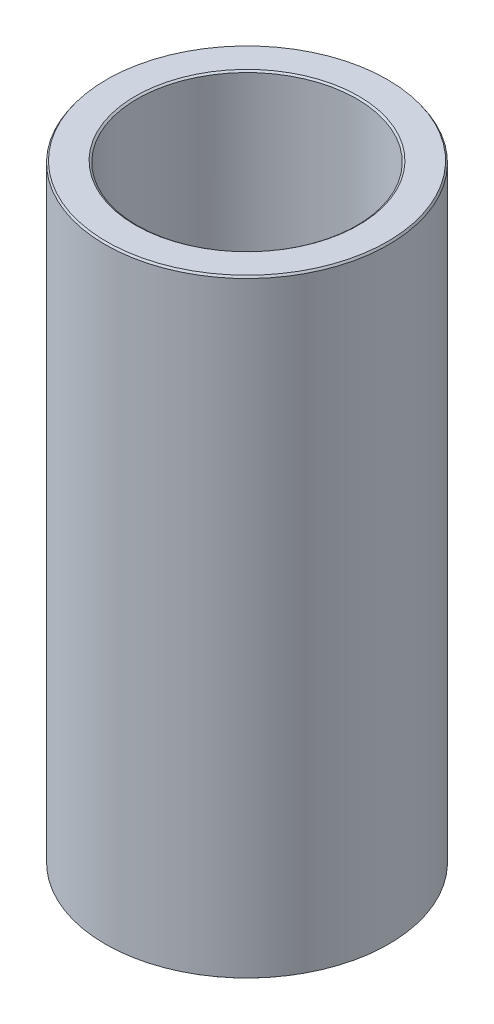
from build123d import *
from OCP.BRepFilletAPI import BRepFilletAPI_MakeChamfer

# Parameters (mm, degrees)
SKETCH1_R           = 35
BOSS_EXTRUDE1_DEPTH = 150.343041636
SKETCH2_R           = 27.102087531
CUT_EXTRUDE1_DEPTH  = 159.28149029
CHAMFER1_SIZE       = 0.471211475
CHAMFER1_SIZE2      = 0.338114798


with BuildPart() as part:
    # Sketch1 → Boss-Extrude1 (new body)
    with BuildSketch(Plane(origin=(0, 0, 0), x_dir=(1, 0, 0), z_dir=(0, 1, 0))):
        Circle(SKETCH1_R)
    extrude(amount=BOSS_EXTRUDE1_DEPTH)

    # Sketch2 → Cut-Extrude1 (cut, through all)
    with BuildSketch(Plane(origin=(0, 0, 0), x_dir=(1, 0, 0), z_dir=(0, 1, 0))):
        Circle(SKETCH2_R)
    extrude(amount=CUT_EXTRUDE1_DEPTH, mode=Mode.SUBTRACT)

    # Chamfer1: one chamfer whose edges measure the first distance from different faces: ONE call of the kernel's chamfer builder (chamfer() names one face for all edges)
    chamfer1_edges_1 = [part.edges().sort_by_distance(p)[0] for p in [
        (-27.102087531, 150.343041636, 0),
    ]]
    chamfer1_side_1 = [part.faces().sort_by_distance(p)[0] for p in [
        (-34.010050506, 150.343041636, 0),
    ]]
    chamfer1_edges_2 = [part.edges().sort_by_distance(p)[0] for p in [
        (-27.102087531, 0, 0),
    ]]
    chamfer1_side_2 = [part.faces().sort_by_distance(p)[0] for p in [
        (-27.102087531, 75.171520818, 0),
    ]]
    chamfer1_edges_3 = [part.edges().sort_by_distance(p)[0] for p in [
        (-35, 0, 0),
    ]]
    chamfer1_side_3 = [part.faces().sort_by_distance(p)[0] for p in [
        (-34.010050506, 0, 0),
    ]]
    chamfer1_edges_4 = [part.edges().sort_by_distance(p)[0] for p in [
        (-35, 150.343041636, 0),
    ]]
    chamfer1_side_4 = [part.faces().sort_by_distance(p)[0] for p in [
        (-35, 75.171520818, 0),
    ]]
    chamfer1 = BRepFilletAPI_MakeChamfer(part.part.solid().wrapped)
    for e in chamfer1_edges_1:
        chamfer1.Add(CHAMFER1_SIZE, CHAMFER1_SIZE2, e.wrapped, chamfer1_side_1[0].wrapped)  # the first distance lies on this face
    for e in chamfer1_edges_2:
        chamfer1.Add(CHAMFER1_SIZE, CHAMFER1_SIZE2, e.wrapped, chamfer1_side_2[0].wrapped)  # the first distance lies on this face
    for e in chamfer1_edges_3:
        chamfer1.Add(CHAMFER1_SIZE, CHAMFER1_SIZE2, e.wrapped, chamfer1_side_3[0].wrapped)  # the first distance lies on this face
    for e in chamfer1_edges_4:
        chamfer1.Add(CHAMFER1_SIZE, CHAMFER1_SIZE2, e.wrapped, chamfer1_side_4[0].wrapped)  # the first distance lies on this face
    add(Compound.cast(chamfer1.Shape()), mode=Mode.REPLACE)


solid = part.part
